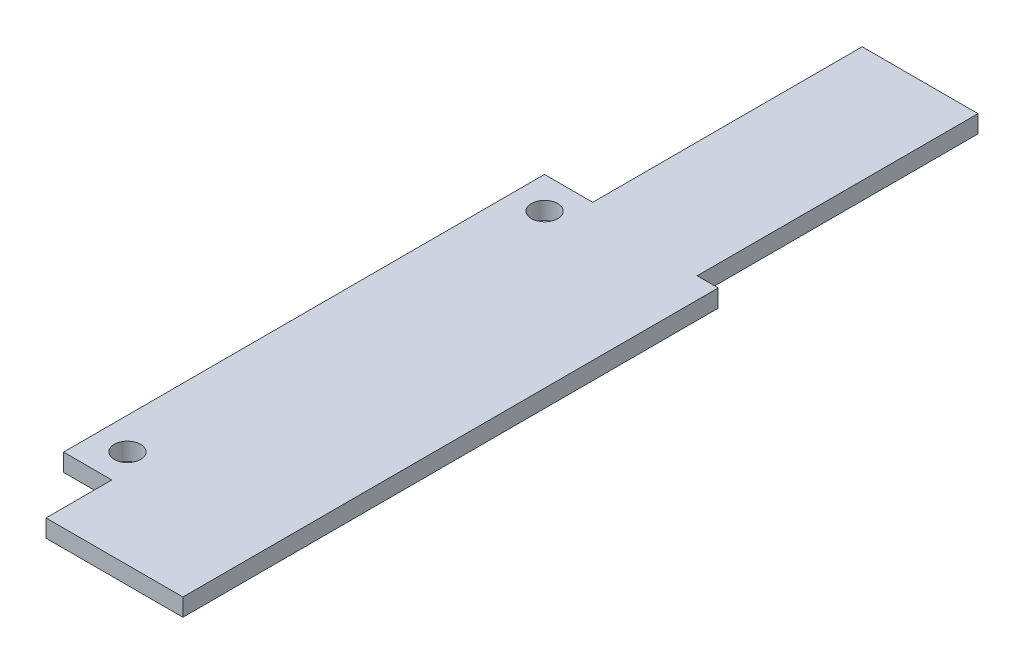
from build123d import *

# Parameters (mm, degrees)
BOSS_EXTRUDE1_DEPTH = 1.5
SKETCH2_W           = 4.8
SKETCH2_H           = 18
BOSS_EXTRUDE2_DEPTH = 20
SKETCH3_R           = 1.5
CUT_EXTRUDE1_DEPTH  = 20
SKETCH4_R           = 3
SKETCH4_R_2         = 1.5
SKETCH4_W           = 4.828517764
SKETCH4_H           = 3.2
SKETCH4_W_2         = 5.829541735
SKETCH4_H_2         = 5.702554953
SKETCH4_W_3         = 4.58984945
BOSS_EXTRUDE3_DEPTH = 3.8
SKETCH5_W           = 7.960049614
SKETCH5_H           = 4.589179968
SKETCH5_R           = 1.5
SKETCH5_W_2         = 8.506770289
SKETCH5_H_2         = 5.091999219
SKETCH5_W_3         = 7.172313144
SKETCH5_H_3         = 12.5
SKETCH5_H_4         = 13
BOSS_EXTRUDE4_DEPTH = 4.25
SKETCH6_W           = 6.917388718
SKETCH6_H           = 7.693263261
SKETCH6_R           = 1.5
SKETCH6_W_2         = 6.017640473
SKETCH6_H_2         = 7.169329529
BOSS_EXTRUDE5_DEPTH = 12.5
SKETCH7_R           = 1.5
BOSS_EXTRUDE7_DEPTH = 2
INTERSECT1_DEPTH    = 21.5


# Read off the part's stored shape, not the designer's step: Intersect1
with BuildPart() as part:
    # Sketch1 → Boss-Extrude1 (new body)
    with BuildSketch(Plane(origin=(0, 0, 0), x_dir=(1, 0, 0), z_dir=(0, 1, 0))):
        Polygon((-60, -67.5), (-60, -72.5), (-52, -72.5), (-52, -67.5), (52, -67.5), (52, -72.5), (60, -72.5), (60, -67.5), (60, 67.5), (-60, 67.5), (-60, 36.8), (-65.5, 36.8), (-65.5, 29.3), (-60, 29.3), (-60, 16.8), (-65.5, 16.8), (-65.5, 7.8), (-65.5, -1.2), (-60, -1.2), (-60, -10.5), (-65.5, -10.5), (-65.5, -18), (-60, -18), align=None)
    extrude(amount=BOSS_EXTRUDE1_DEPTH)

    # Sketch2 → Boss-Extrude2 (add)
    with BuildSketch(Plane(origin=(0, 1.5, 0), x_dir=(1, 0, 0), z_dir=(0, 1, 0))):
        Polygon((-58, 62.8), (-58, 29.3), (-60, 29.3), (-65.5, 29.3), (-65.5, 36.8), (-60, 36.8), (-60, 67.5), (-55.3, 67.5), (-55.3, 65.5), align=None)
        with BuildLine():
            Line((-58, -65.5), (58, -65.5))
            Line((58, -65.5), (58, -25.5))
            Line((58, -25.5), (29.8, -25.5))
            Line((29.8, -25.5), (29.8, -18))
            Line((29.8, -18), (58, -18))
            Line((58, -18), (58, 38.5))
            ThreePointArc((58, 38.5), (57.414213562, 39.914213562), (56, 40.5))
            Line((56, 40.5), (51.8, 40.5))
            ThreePointArc((51.8, 40.5), (50.385786438, 41.085786438), (49.8, 42.5))
            Line((49.8, 42.5), (49.8, 48.75))
            Line((49.8, 48.75), (51.3, 48.75))
            Line((51.3, 48.75), (51.3, 47.25))
            Line((51.3, 47.25), (58, 47.25))
            Line((58, 47.25), (58, 51.25))
            Line((58, 51.25), (60, 51.25))
            Line((60, 51.25), (60, -72.5))
            Line((60, -72.5), (52, -72.5))
            Line((52, -72.5), (52, -67.5))
            Line((52, -67.5), (-52, -67.5))
            Line((-52, -67.5), (-52, -72.5))
            Line((-52, -72.5), (-60, -72.5))
            Line((-60, -72.5), (-60, -52.5))
            Line((-60, -52.5), (-58, -52.5))
            Line((-58, -52.5), (-58, -65.5))
        make_face()
        Polygon((-60, 16.8), (-58, 16.8), (-58, -1.2), (-60, -1.2), (-65.5, -1.2), (-65.5, 16.8), align=None)
        Polygon((-60, -10.5), (-58, -10.5), (-58, -38), (-60, -38), (-60, -18), (-65.5, -18), (-65.5, -10.5), align=None)
        with BuildLine():
            Line((-48.8, 67.5), (-48.8, 65.5))
            Line((-48.8, 65.5), (-46.8, 62.8))
            Line((-46.8, 62.8), (-46.8, 58.5))
            Line((-46.8, 58.5), (-44.8, 58.5))
            Line((-44.8, 58.5), (-37.8, 64.5))
            Line((-37.8, 64.5), (38.8, 64.5))
            Line((38.8, 64.5), (44.8, 58.5))
            Line((44.8, 58.5), (44.8, 46.5))
            Line((44.8, 46.5), (41.3, 46.5))
            Line((41.3, 46.5), (41.3, 42.5))
            Line((41.3, 42.5), (38.85, 42.5))
            Line((38.85, 42.5), (38.85, 40.5))
            Line((38.85, 40.5), (44.8, 40.5))
            ThreePointArc((44.8, 40.5), (46.214213562, 41.085786438), (46.8, 42.5))
            Line((46.8, 42.5), (46.8, 46.5))
            Line((46.8, 46.5), (46.8, 57.25))
            Line((46.8, 57.25), (51.3, 57.25))
            Line((51.3, 57.25), (51.3, 58.75))
            Line((51.3, 58.75), (58, 58.75))
            Line((58, 58.75), (58, 54.75))
            Line((58, 54.75), (60, 54.75))
            Line((60, 54.75), (60, 67.5))
            Line((60, 67.5), (-48.8, 67.5))
        make_face()
        Polygon((-46.8, 46.5), (-39.5, 46.5), (-39.5, 42.5), (-37.05, 42.5), (-37.05, 40.5), (-46.8, 40.5), align=None)
        Polygon((-33.55, 42.5), (-33.55, 40.5), (-18.65, 40.5), (-18.65, 42.5), (-21.1, 42.5), (-21.1, 46.5), (-31.1, 46.5), (-31.1, 42.5), align=None)
        Polygon((-15.55, 40.5), (-0.65, 40.5), (-0.65, 42.5), (-3.1, 42.5), (-3.1, 46.5), (-13.1, 46.5), (-13.1, 42.5), (-15.55, 42.5), align=None)
        Polygon((2.45, 40.5), (17.35, 40.5), (17.35, 42.5), (14.9, 42.5), (14.9, 46.5), (4.9, 46.5), (4.9, 42.5), (2.45, 42.5), align=None)
        Polygon((20.45, 40.5), (35.35, 40.5), (35.35, 42.5), (32.9, 42.5), (32.9, 46.5), (22.9, 46.5), (22.9, 42.5), (20.45, 42.5), align=None)
        Polygon((-46.8, 35.5), (-49.2, 35.5), (-49.2, 29.3), (-44.4, 29.3), (-44.4, 35.5), align=None)
        with Locations((-46.8, 7.8)):
            Rectangle(SKETCH2_W, SKETCH2_H)
        Polygon((-49.2, -10.5), (-44.4, -10.5), (-44.4, -18), (-16.9, -18), (-16.9, -25.5), (-46.4, -25.5), (-46.4, -19.9), (-49.2, -14), align=None)
    extrude(amount=BOSS_EXTRUDE2_DEPTH)

    # Sketch3 → Cut-Extrude1 (cut)
    with BuildSketch(Plane(origin=(0, 21.5, 0), x_dir=(1, 0, 0), z_dir=(0, 1, 0))):
        with Locations(Location((52.774715074, 63.354517547, 0), (0, 0, 270))):
            Circle(SKETCH3_R)
        with Locations(Location((-43.84271688, 64.854517547, 0), (0, 0, 270))):
            Circle(SKETCH3_R)
        with Locations(Location((-61.879270776, 33.191143968, 0), (0, 0, 270))):
            Circle(SKETCH3_R)
        with Locations(Location((-61.879270776, -14.337618299, 0), (0, 0, 270))):
            Circle(SKETCH3_R)
        with Locations(Location((54.274715074, 43.945098524, 0), (0, 0, 270))):
            Circle(SKETCH3_R)
        with Locations(Location((-21.029637868, -21.862387391, 0), (0, 0, 270))):
            Circle(SKETCH3_R)
        with Locations(Location((34.3, -21.75, 0), (0, 0, 270))):
            Circle(SKETCH3_R)
        with Locations(Location((-56, -69, 0), (0, 0, 270))):
            Circle(SKETCH3_R)
        with Locations(Location((56, -69, 0), (0, 0, 270))):
            Circle(SKETCH3_R)
    extrude(amount=-CUT_EXTRUDE1_DEPTH, mode=Mode.SUBTRACT)

    # Sketch4 → Boss-Extrude3 (add)
    # profile 1 of 5: a face of its own
    with BuildSketch(Plane(origin=(0, 1.5, 0), x_dir=(1, 0, 0), z_dir=(0, 1, 0))):
        with Locations(Location((21.544764921, -8.320497528, 0), (0, 0, 90))):
            Circle(SKETCH4_R)
        with Locations(Location((21.544764921, -8.320497528, 0), (0, 0, 90))):
            Circle(SKETCH4_R_2, mode=Mode.SUBTRACT)
    # profile 2 of 5: a face of its own
    with BuildSketch(Plane(origin=(0, 1.5, 0), x_dir=(1, 0, 0), z_dir=(0, 1, 0))):
        with Locations(Location((21.544764921, 19.479502472, 0), (0, 0, 90))):
            Circle(SKETCH4_R)
        with Locations(Location((21.544764921, 19.479502472, 0), (0, 0, 90))):
            Circle(SKETCH4_R_2, mode=Mode.SUBTRACT)
    # profile 3 of 5: a face of its own
    with BuildSketch(Plane(origin=(0, 1.5, 0), x_dir=(1, 0, 0), z_dir=(0, 1, 0))):
        with Locations((-29.2, 33.9)):
            Rectangle(SKETCH4_W, SKETCH4_H)
        with Locations(Location((-29.2, 33.9, 0), (0, 0, 90))):
            Circle(SKETCH4_R_2, mode=Mode.SUBTRACT)
    # profile 4 of 5: a face of its own
    with BuildSketch(Plane(origin=(0, 1.5, 0), x_dir=(1, 0, 0), z_dir=(0, 1, 0))):
        with Locations((-30.25253813, -15.148722524)):
            Rectangle(SKETCH4_W_2, SKETCH4_H_2)
        with Locations(Location((-30.3, -14.4, 0), (0, 0, 90))):
            Circle(SKETCH4_R_2, mode=Mode.SUBTRACT)
    # profile 5 of 5: a face of its own
    with BuildSketch(Plane(origin=(0, 1.5, 0), x_dir=(1, 0, 0), z_dir=(0, 1, 0))):
        with Locations((51.718864017, -15.148722524)):
            Rectangle(SKETCH4_W_3, SKETCH4_H_2)
        with Locations(Location((51.8, -14.4, 0), (0, 0, 90))):
            Circle(SKETCH4_R_2, mode=Mode.SUBTRACT)
    extrude(amount=BOSS_EXTRUDE3_DEPTH)

    # Sketch5 → Boss-Extrude4 (add)
    # profile 1 of 4: a face of its own
    with BuildSketch(Plane(origin=(0, 1.5, 0), x_dir=(1, 0, 0), z_dir=(0, 1, 0))):
        with Locations((-54.019975193, -35.705410016)):
            Rectangle(SKETCH5_W, SKETCH5_H)
        with Locations(Location((-52.773553759, -35.8, 0), (0, 0, 270))):
            Circle(SKETCH5_R, mode=Mode.SUBTRACT)
    # profile 2 of 4: a face of its own
    with BuildSketch(Plane(origin=(0, 1.5, 0), x_dir=(1, 0, 0), z_dir=(0, 1, 0))):
        with Locations((-53.746614856, -55.04599961)):
            Rectangle(SKETCH5_W_2, SKETCH5_H_2)
        with Locations(Location((-52.773553759, -54.7, 0), (0, 0, 270))):
            Circle(SKETCH5_R, mode=Mode.SUBTRACT)
    # profile 3 of 4: a face of its own
    with BuildSketch(Plane(origin=(0, 1.5, 0), x_dir=(1, 0, 0), z_dir=(0, 1, 0))):
        with Locations((-27.40354529, -31.75)):
            Rectangle(SKETCH5_W_3, SKETCH5_H_3)
        with Locations(Location((-27.173553759, -35.8, 0), (0, 0, 270))):
            Circle(SKETCH5_R, mode=Mode.SUBTRACT)
    # profile 4 of 4: a face of its own
    with BuildSketch(Plane(origin=(0, 1.5, 0), x_dir=(1, 0, 0), z_dir=(0, 1, 0))):
        with Locations((-27.40354529, -59)):
            Rectangle(SKETCH5_W_3, SKETCH5_H_4)
        with Locations(Location((-27.173553759, -54.7, 0), (0, 0, 270))):
            Circle(SKETCH5_R, mode=Mode.SUBTRACT)
    extrude(amount=BOSS_EXTRUDE4_DEPTH)

    # Sketch6 → Boss-Extrude5 (add)
    # profile 1 of 4: a face of its own
    with BuildSketch(Plane(origin=(0, 1.5, 0), x_dir=(1, 0, 0), z_dir=(0, 1, 0))):
        with Locations((-20.358694359, -29.346631631)):
            Rectangle(SKETCH6_W, SKETCH6_H)
        with Locations(Location((-19.26, -30.5, 0), (0, 0, 270))):
            Circle(SKETCH6_R, mode=Mode.SUBTRACT)
    # profile 2 of 4: a face of its own
    with BuildSketch(Plane(origin=(0, 1.5, 0), x_dir=(1, 0, 0), z_dir=(0, 1, 0))):
        with Locations((54.991179763, -29.346631631)):
            Rectangle(SKETCH6_W_2, SKETCH6_H)
        with Locations(Location((55.14, -30.5, 0), (0, 0, 270))):
            Circle(SKETCH6_R, mode=Mode.SUBTRACT)
    # profile 3 of 4: a face of its own
    with BuildSketch(Plane(origin=(0, 1.5, 0), x_dir=(1, 0, 0), z_dir=(0, 1, 0))):
        with Locations((54.991179763, -61.915335236)):
            Rectangle(SKETCH6_W_2, SKETCH6_H_2)
        with Locations(Location((55.14, -61.1, 0), (0, 0, 270))):
            Circle(SKETCH6_R, mode=Mode.SUBTRACT)
    # profile 4 of 4: a face of its own
    with BuildSketch(Plane(origin=(0, 1.5, 0), x_dir=(1, 0, 0), z_dir=(0, 1, 0))):
        with Locations((-20.358694359, -61.915335236)):
            Rectangle(SKETCH6_W, SKETCH6_H_2)
        with Locations(Location((-19.26, -61.1, 0), (0, 0, 270))):
            Circle(SKETCH6_R, mode=Mode.SUBTRACT)
    extrude(amount=BOSS_EXTRUDE5_DEPTH)

    # Intersect1 outline → Intersect1 (cut)
    with BuildSketch(Plane(origin=(0, 0, 0), x_dir=(1, 0, 0), z_dir=(0, 1, 0))):
        Polygon((-60, -72.5), (-52, -72.5), (-52, -67.5), (52, -67.5), (52, -72.5), (60, -72.5), (60, 67.5), (-60, 67.5), (-60, 36.8), (-65.5, 36.8), (-65.5, 29.3), (-60, 29.3), (-60, 16.8), (-65.5, 16.8), (-65.5, -1.2), (-60, -1.2), (-60, -10.5), (-65.5, -10.5), (-65.5, -18), (-60, -18), align=None)
    extrude(amount=INTERSECT1_DEPTH, mode=Mode.SUBTRACT)


with BuildPart() as body_2:
    # Sketch7 → Boss-Extrude7 (new body)
    with BuildSketch(Plane(origin=(0, 21.5, 0), x_dir=(1, 0, 0), z_dir=(0, 1, 0))):
        Polygon((-60, 67.5), (-60, 36.8), (-65.5, 36.8), (-65.5, -18), (-60, -18), (-60, -25.5), (-46.4, -25.5), (-44.4, -25.5), (-44.4, -10.5), (-44.4, 35.5), (-46.8, 35.5), (-46.8, 62.8), (-46.8, 67.5), align=None)
        with Locations(Location((-61.879270776, -14.337618299, 0), (0, 0, 270))):
            Circle(SKETCH7_R, mode=Mode.SUBTRACT)
        with Locations(Location((-61.879270776, 33.191143968, 0), (0, 0, 270))):
            Circle(SKETCH7_R, mode=Mode.SUBTRACT)
    extrude(amount=BOSS_EXTRUDE7_DEPTH)


solid = body_2.part
